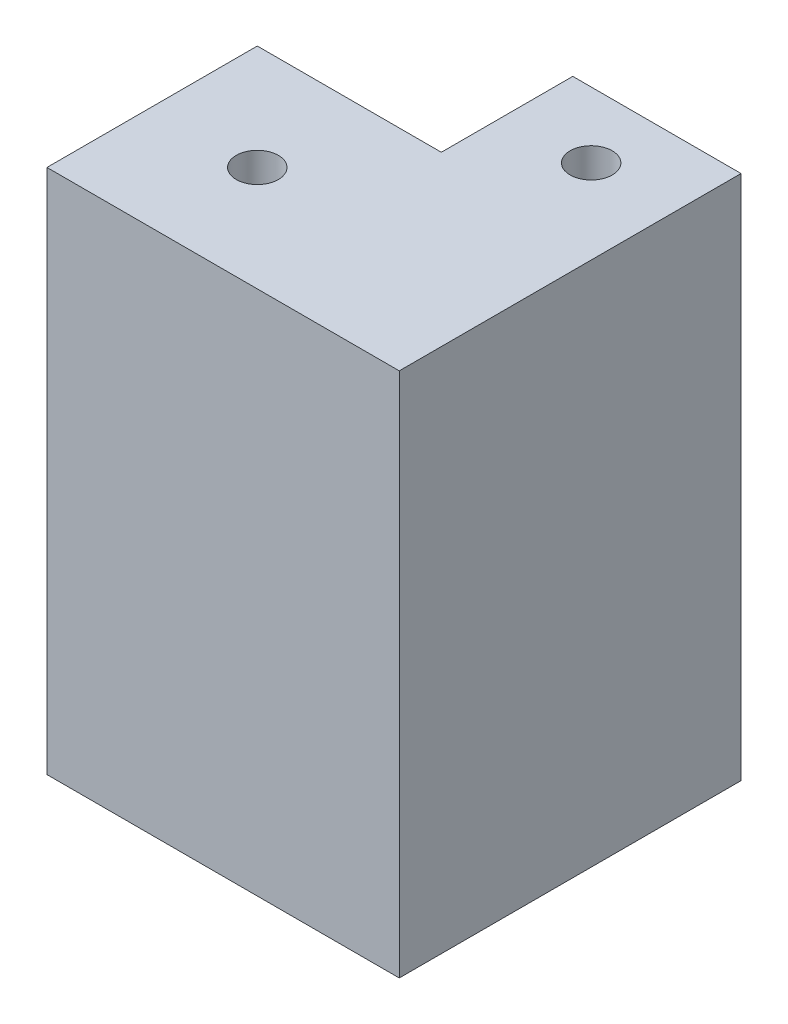
from build123d import *

# Parameters (mm, degrees)
SKETCH1_R                               = 4
BOSS_EXTRUDE1_DEPTH                     = 100
CBORE_FOR_M5_HEX_HEAD_BOLT2_D           = 13.5
CBORE_FOR_M5_HEX_HEAD_BOLT2_DEPTH       = 23.85
CBORE_FOR_M5_HEX_HEAD_BOLT2_CBORE_D     = 32
CBORE_FOR_M5_HEX_HEAD_BOLT2_CBORE_DEPTH = 5
CBORE_FOR_M5_HEX_HEAD_BOLT3_D           = 10.2
CBORE_FOR_M5_HEX_HEAD_BOLT3_DEPTH       = 13.5
CBORE_FOR_M5_HEX_HEAD_BOLT3_CBORE_D     = 22
CBORE_FOR_M5_HEX_HEAD_BOLT3_CBORE_DEPTH = 3.5


with BuildPart() as part:
    # Sketch1 → Boss-Extrude1 (new body)
    with BuildSketch(Plane(origin=(0, 0, 0), x_dir=(1, 0, 0), z_dir=(0, 1, 0))):
        Polygon((-35, 0), (0, 0), (0, 25), (32, 25), (32, -40), (-35, -40), align=None)
        with Locations((-15, -20)):
            Circle(SKETCH1_R, mode=Mode.SUBTRACT)
        with Locations((16, 12.5)):
            Circle(SKETCH1_R, mode=Mode.SUBTRACT)
    extrude(amount=BOSS_EXTRUDE1_DEPTH)

    # CBORE for M5 Hex Head Bolt2
    with Locations(Plane(origin=(0, 0, 0), x_dir=(-1, 0, 0), z_dir=(0, -1, 0))):
        with Locations((15, -20)):
            CounterBoreHole(CBORE_FOR_M5_HEX_HEAD_BOLT2_D / 2, CBORE_FOR_M5_HEX_HEAD_BOLT2_CBORE_D / 2, CBORE_FOR_M5_HEX_HEAD_BOLT2_CBORE_DEPTH, depth=CBORE_FOR_M5_HEX_HEAD_BOLT2_DEPTH)

    # CBORE for M5 Hex Head Bolt3
    with Locations(Plane(origin=(0, 0, 0), x_dir=(-1, 0, 0), z_dir=(0, -1, 0))):
        with Locations((-16, 12.5)):
            CounterBoreHole(CBORE_FOR_M5_HEX_HEAD_BOLT3_D / 2, CBORE_FOR_M5_HEX_HEAD_BOLT3_CBORE_D / 2, CBORE_FOR_M5_HEX_HEAD_BOLT3_CBORE_DEPTH, depth=CBORE_FOR_M5_HEX_HEAD_BOLT3_DEPTH)


solid = part.part
